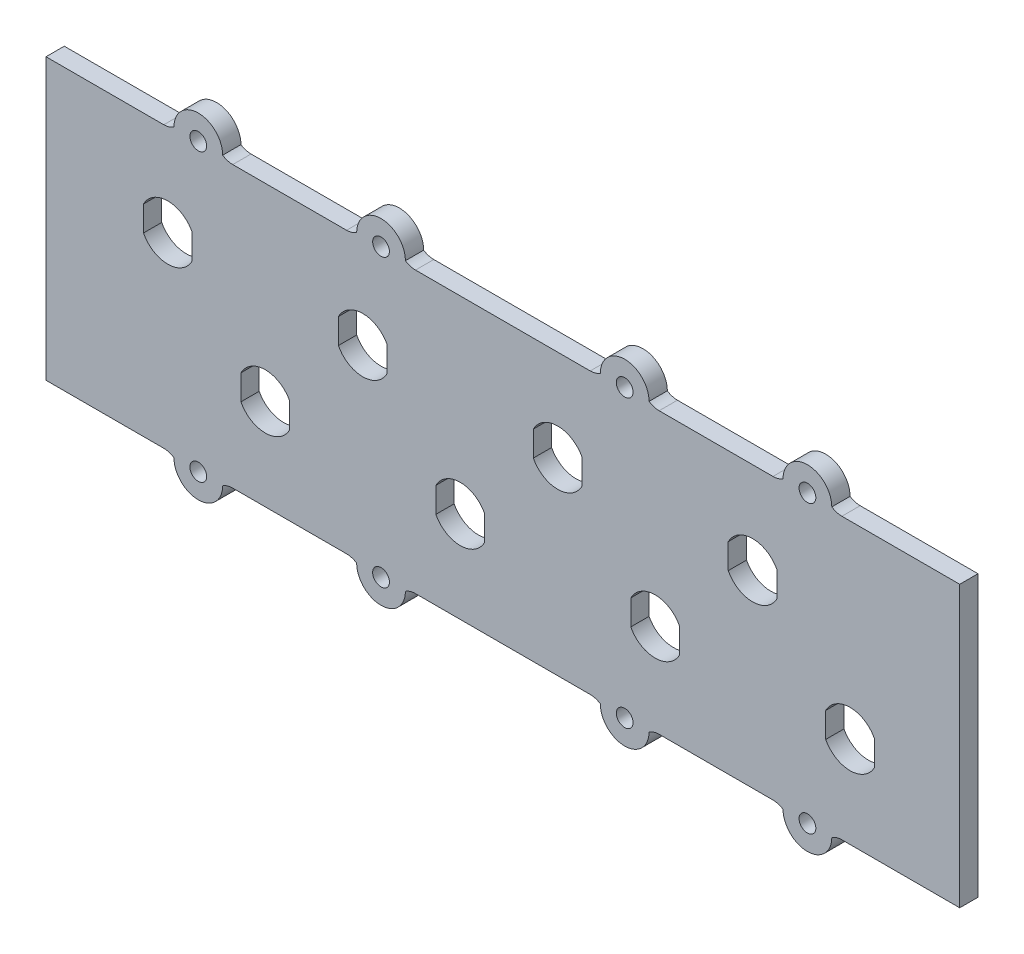
from build123d import *

# Parameters (mm, degrees)
SKETCH1_R           = 1.375
BOSS_EXTRUDE1_DEPTH = 3


with BuildPart() as part:
    # Sketch1 → Boss-Extrude1 (new body)
    with BuildSketch(Plane.XY):
        with BuildLine():
            Line((-55.658312395, 23), (-75, 23))
            Line((-75, 23), (-75, -23))
            Line((-75, -23), (-55.658312395, -23))
            ThreePointArc((-55.658312395, -23), (-54.792286991, -23.127718677), (-54, -23.5))
            ThreePointArc((-54, -23.5), (-50, -27.5), (-46, -23.5))
            ThreePointArc((-46, -23.5), (-45.207713009, -23.127718677), (-44.341687605, -23))
            Line((-44.341687605, -23), (-25.658312395, -23))
            ThreePointArc((-25.658312395, -23), (-24.792286991, -23.127718677), (-24, -23.5))
            ThreePointArc((-24, -23.5), (-20, -27.5), (-16, -23.5))
            ThreePointArc((-16, -23.5), (-15.207713009, -23.127718677), (-14.341687605, -23))
            Line((-14.341687605, -23), (14.341687605, -23))
            ThreePointArc((14.341687605, -23), (15.207713009, -23.127718677), (16, -23.5))
            ThreePointArc((16, -23.5), (20, -27.5), (24, -23.5))
            ThreePointArc((24, -23.5), (24.792286991, -23.127718677), (25.658312395, -23))
            Line((25.658312395, -23), (44.341687605, -23))
            ThreePointArc((44.341687605, -23), (45.207713009, -23.127718677), (46, -23.5))
            ThreePointArc((46, -23.5), (50, -27.5), (54, -23.5))
            ThreePointArc((54, -23.5), (54.792286991, -23.127718677), (55.658312395, -23))
            Line((55.658312395, -23), (75, -23))
            Line((75, -23), (75, 23))
            Line((75, 23), (55.658312395, 23))
            ThreePointArc((55.658312395, 23), (54.792286991, 23.127718677), (54, 23.5))
            ThreePointArc((54, 23.5), (50, 27.5), (46, 23.5))
            ThreePointArc((46, 23.5), (45.207713009, 23.127718677), (44.341687605, 23))
            Line((44.341687605, 23), (25.658312395, 23))
            ThreePointArc((25.658312395, 23), (24.792286991, 23.127718677), (24, 23.5))
            ThreePointArc((24, 23.5), (20, 27.5), (16, 23.5))
            ThreePointArc((16, 23.5), (15.207713009, 23.127718677), (14.341687605, 23))
            Line((14.341687605, 23), (-14.341687605, 23))
            ThreePointArc((-14.341687605, 23), (-15.207713009, 23.127718677), (-16, 23.5))
            ThreePointArc((-16, 23.5), (-20, 27.5), (-24, 23.5))
            ThreePointArc((-24, 23.5), (-24.792286991, 23.127718677), (-25.658312395, 23))
            Line((-25.658312395, 23), (-44.341687605, 23))
            ThreePointArc((-44.341687605, 23), (-45.207713009, 23.127718677), (-46, 23.5))
            ThreePointArc((-46, 23.5), (-50, 27.5), (-54, 23.5))
            ThreePointArc((-54, 23.5), (-54.792286991, 23.127718677), (-55.658312395, 23))
        make_face()
        with Locations((-50, -23.5)):
            Circle(SKETCH1_R, mode=Mode.SUBTRACT)
        with Locations((-20, -23.5)):
            Circle(SKETCH1_R, mode=Mode.SUBTRACT)
        with BuildLine():
            ThreePointArc((-35, -10.061552813), (-39, -12.5), (-43, -10.061552813))
            Line((-43, -10.061552813), (-43, -5.938447187))
            ThreePointArc((-43, -5.938447187), (-39, -3.5), (-35, -5.938447187))
            Line((-35, -5.938447187), (-35, -10.061552813))
        make_face(mode=Mode.SUBTRACT)
        with BuildLine():
            ThreePointArc((-3, -10.061552813), (-7, -12.5), (-11, -10.061552813))
            Line((-11, -10.061552813), (-11, -5.938447187))
            ThreePointArc((-11, -5.938447187), (-7, -3.5), (-3, -5.938447187))
            Line((-3, -5.938447187), (-3, -10.061552813))
        make_face(mode=Mode.SUBTRACT)
        with Locations((20, -23.5)):
            Circle(SKETCH1_R, mode=Mode.SUBTRACT)
        with Locations((50, -23.5)):
            Circle(SKETCH1_R, mode=Mode.SUBTRACT)
        with BuildLine():
            ThreePointArc((29, -10.061552813), (25, -12.5), (21, -10.061552813))
            Line((21, -10.061552813), (21, -5.938447187))
            ThreePointArc((21, -5.938447187), (25, -3.5), (29, -5.938447187))
            Line((29, -5.938447187), (29, -10.061552813))
        make_face(mode=Mode.SUBTRACT)
        with BuildLine():
            ThreePointArc((61, -10.061552813), (57, -12.5), (53, -10.061552813))
            Line((53, -10.061552813), (53, -5.938447187))
            ThreePointArc((53, -5.938447187), (57, -3.5), (61, -5.938447187))
            Line((61, -5.938447187), (61, -10.061552813))
        make_face(mode=Mode.SUBTRACT)
        with BuildLine():
            ThreePointArc((-59, 10.061552813), (-55, 12.5), (-51, 10.061552813))
            Line((-51, 10.061552813), (-51, 5.938447187))
            ThreePointArc((-51, 5.938447187), (-55, 3.5), (-59, 5.938447187))
            Line((-59, 5.938447187), (-59, 10.061552813))
        make_face(mode=Mode.SUBTRACT)
        with BuildLine():
            ThreePointArc((-19, 5.938447187), (-23, 3.5), (-27, 5.938447187))
            Line((-27, 5.938447187), (-27, 10.061552813))
            ThreePointArc((-27, 10.061552813), (-23, 12.5), (-19, 10.061552813))
            Line((-19, 10.061552813), (-19, 5.938447187))
        make_face(mode=Mode.SUBTRACT)
        with Locations((-50, 23.5)):
            Circle(SKETCH1_R, mode=Mode.SUBTRACT)
        with Locations((-20, 23.5)):
            Circle(SKETCH1_R, mode=Mode.SUBTRACT)
        with BuildLine():
            ThreePointArc((13, 5.938447187), (9, 3.5), (5, 5.938447187))
            Line((5, 5.938447187), (5, 10.061552813))
            ThreePointArc((5, 10.061552813), (9, 12.5), (13, 10.061552813))
            Line((13, 10.061552813), (13, 5.938447187))
        make_face(mode=Mode.SUBTRACT)
        with BuildLine():
            ThreePointArc((45, 5.938447187), (41, 3.5), (37, 5.938447187))
            Line((37, 5.938447187), (37, 10.061552813))
            ThreePointArc((37, 10.061552813), (41, 12.5), (45, 10.061552813))
            Line((45, 10.061552813), (45, 5.938447187))
        make_face(mode=Mode.SUBTRACT)
        with Locations((20, 23.5)):
            Circle(SKETCH1_R, mode=Mode.SUBTRACT)
        with Locations((50, 23.5)):
            Circle(SKETCH1_R, mode=Mode.SUBTRACT)
    extrude(amount=BOSS_EXTRUDE1_DEPTH)


solid = part.part
